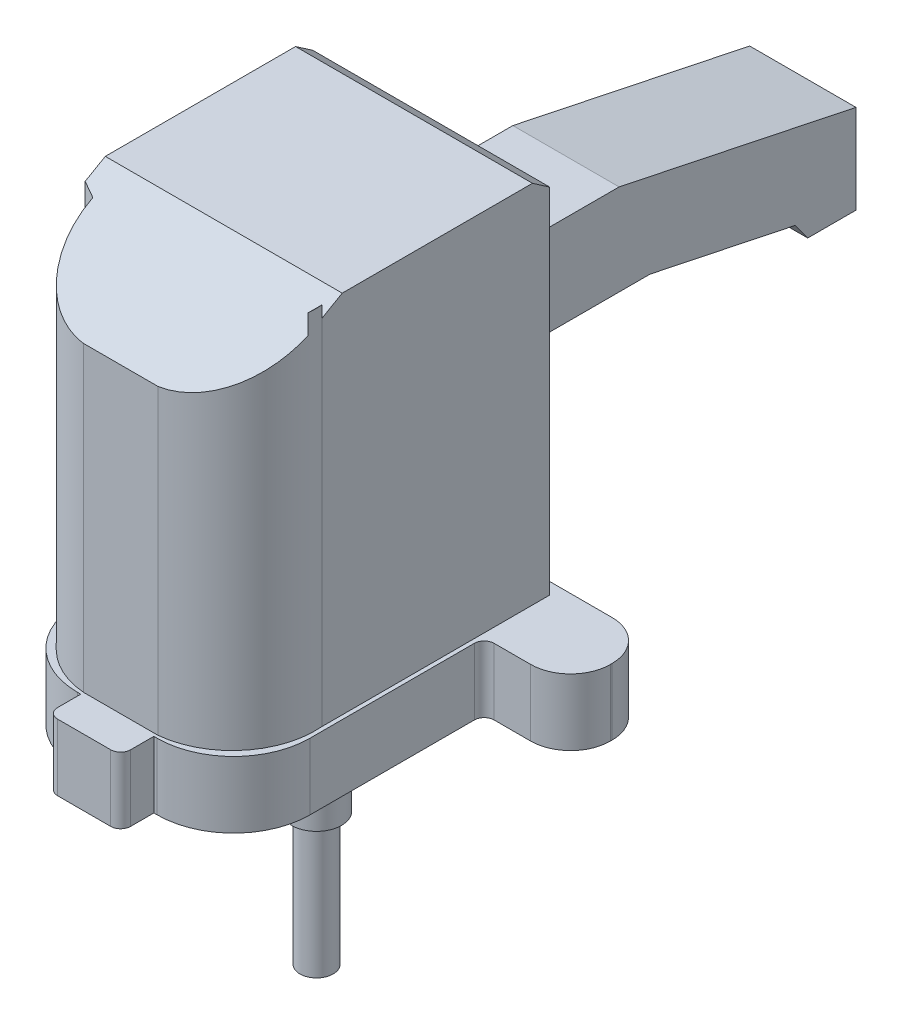
from build123d import *

# Parameters (mm, degrees)
SKETCH_1_R          = 2
SKETCH_1_R_2        = 10
EXTRUDE_1_DEPTH     = 20
SKETCH_2_R          = 25
SKETCH_2_R_2        = 12
EXTRUDE_2_DEPTH     = 2
EXTRUDE_3_DEPTH     = 110
SKETCH_4_OUTSIDE_W  = 274.729
SKETCH_4_OUTSIDE_H  = 190.272
CUT_EXTRUDE_5_DEPTH = 218.555717227
SKETCH_5_R          = 7.5
EXTRUDE_4_DEPTH     = 55
SKETCH_6_R          = 5
EXTRUDE_5_DEPTH     = 40


with BuildPart() as part:
    # Эскиз1 → Бобышка-Вытянуть1 (new body)
    with BuildSketch(Plane(origin=(0, 0, 0), x_dir=(1, 0, 0), z_dir=(0, 1, 0))):
        with BuildLine():
            Line((35, 12.5), (35, -37))
            ThreePointArc((35, -37), (28.263455967, -53.263455967), (12, -60))
            Line((12, -60), (11, -60))
            Line((11, -60), (11, -67))
            ThreePointArc((11, -67), (10.121320344, -69.121320344), (8, -70))
            Line((8, -70), (-8, -70))
            ThreePointArc((-8, -70), (-10.121320344, -69.121320344), (-11, -67))
            Line((-11, -67), (-11, -60))
            Line((-11, -60), (-12, -60))
            ThreePointArc((-12, -60), (-28.263455967, -53.263455967), (-35, -37))
            Line((-35, -37), (-35, -35))
            Line((-35, -35), (-37, -35))
            ThreePointArc((-37, -35), (-39.121320344, -34.121320344), (-40, -32))
            Line((-40, -32), (-40, 12.5))
            ThreePointArc((-40, 12.5), (-40.878679656, 14.621320344), (-43, 15.5))
            Line((-43, 15.5), (-49, 15.5))
            ThreePointArc((-49, 15.5), (-57.485281374, 19.014718626), (-61, 27.5))
            Line((-61, 27.5), (-61, 28))
            ThreePointArc((-61, 28), (-57.485281374, 36.485281374), (-49, 40))
            Line((-49, 40), (49, 40))
            ThreePointArc((49, 40), (57.485281374, 36.485281374), (61, 28))
            Line((61, 28), (61, 27.5))
            ThreePointArc((61, 27.5), (57.485281374, 19.014718626), (49, 15.5))
            Line((49, 15.5), (38, 15.5))
            ThreePointArc((38, 15.5), (35.878679656, 14.621320344), (35, 12.5))
        make_face()
        with Locations((27.5, 27.5)):
            Circle(SKETCH_1_R, mode=Mode.SUBTRACT)
        with Locations((-27.5, 27.5)):
            Circle(SKETCH_1_R, mode=Mode.SUBTRACT)
        with Locations((-27.5, -27.5)):
            Circle(SKETCH_1_R, mode=Mode.SUBTRACT)
        with Locations((27.5, -27.5)):
            Circle(SKETCH_1_R, mode=Mode.SUBTRACT)
        Circle(SKETCH_1_R_2, mode=Mode.SUBTRACT)
    extrude(amount=EXTRUDE_1_DEPTH)

    # Эскиз2 → Бобышка-Вытянуть2 (add)
    with BuildSketch(Plane.XZ):
        Circle(SKETCH_2_R)
        Circle(SKETCH_2_R_2, mode=Mode.SUBTRACT)
    extrude(amount=EXTRUDE_2_DEPTH)

    # Эскиз3 → Бобышка-Вытянуть3 (add)
    with BuildSketch(Plane(origin=(0, 20, 0), x_dir=(1, 0, 0), z_dir=(0, 1, 0))):
        with BuildLine():
            Line((-37.583733624, -32.103535028), (-37.583733624, 36.457416544))
            Line((-37.583733624, 36.457416544), (-16, 36.457416544))
            Line((-16, 36.457416544), (-16, 146.457416544))
            Line((-16, 146.457416544), (16, 146.457416544))
            Line((16, 146.457416544), (16, 36.457416544))
            Line((16, 36.457416544), (33.766635678, 36.457416544))
            Line((33.766635678, 36.457416544), (33.766635678, -32.103535028))
            ThreePointArc((33.766635678, -32.103535028), (28.080470389, -50.220903637), (11.304482379, -59.11684357))
            Line((11.304482379, -59.11684357), (-11, -59.11684357))
            ThreePointArc((-11, -59.11684357), (-27.23731375, -51.101673534), (-33.326201299, -34.048264581))
            Line((-33.326201299, -34.048264581), (-37.583733624, -32.103535028))
        make_face()
    extrude(amount=EXTRUDE_3_DEPTH)

    # Эскиз4 outside → Вырез-Вытянуть5 (cut, through all)
    with BuildSketch(Plane(origin=(33.766635678, 0, 0), x_dir=(0, 0, -1), z_dir=(1, 0, 0))):
        with Locations((38.2285, 64)):
            Rectangle(SKETCH_4_OUTSIDE_W, SKETCH_4_OUTSIDE_H)
        Polygon((-59.11684357, 111.009140669), (-59.11684357, 20), (-70, 20), (-70, 0), (-25.61704501, 0), (-25.61704501, -2.465693048), (25.5, -2.465693048), (25.5, 0), (40, 0), (40, 20), (36.457416544, 20), (36.457416544, 70.826498743), (84.412407161, 70.826498743), (128.193178806, 61.67378586), (131.933723793, 56.499947934), (146.457416544, 56.499947934), (146.457416544, 83.32776512), (75.121913518, 98.241010205), (43.39244845, 98.241010205), (36.457416544, 102.079664685), (36.457416544, 126.416047598), (31.26241492, 130), (-26.036858243, 130), align=None, mode=Mode.SUBTRACT)
    extrude(amount=-CUT_EXTRUDE_5_DEPTH, mode=Mode.SUBTRACT)

    # Эскиз5 → Бобышка-Вытянуть4 (add)
    with BuildSketch(Plane.XZ.offset(-20)):
        Circle(SKETCH_5_R)
    extrude(amount=EXTRUDE_4_DEPTH)

    # Эскиз6 → Бобышка-Вытянуть5 (add)
    with BuildSketch(Plane.XZ.offset(35)):
        Circle(SKETCH_6_R)
    extrude(amount=EXTRUDE_5_DEPTH)


solid = part.part
